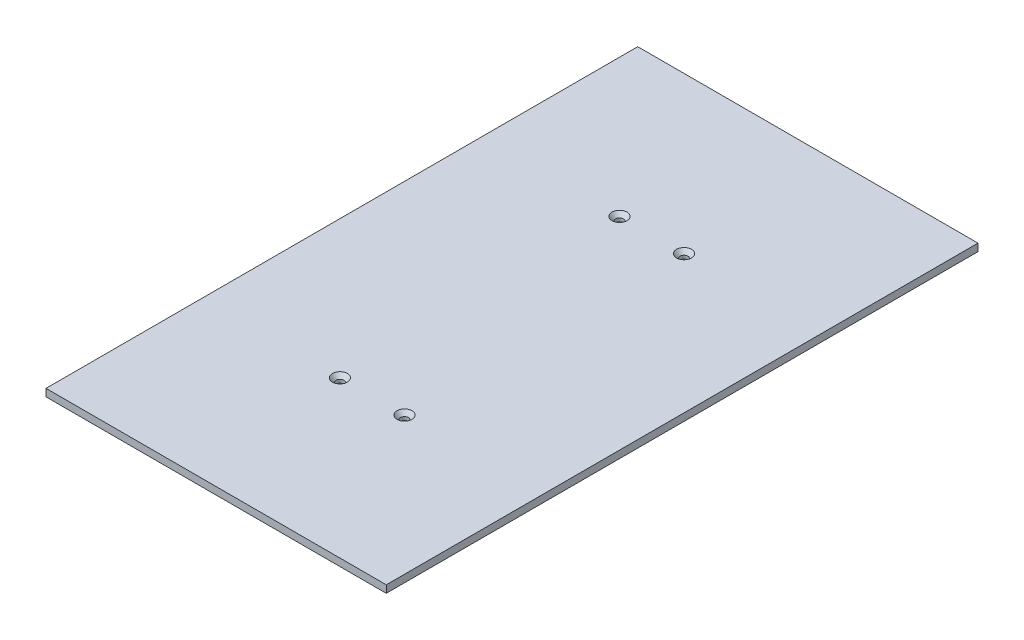
from build123d import *

# Parameters (mm, degrees)
SKETCH1_W                                     = 292.1
SKETCH1_H                                     = 508
BOSS_EXTRUDE1_DEPTH                           = 6.35
CSK_FOR_1_4_FLAT_HEAD_MACHINE_SCREW1_AT_COUNT = 2
CSK_FOR_1_4_FLAT_HEAD_MACHINE_SCREW1_AT_PITCH = 55.4
CSK_FOR_1_4_FLAT_HEAD_MACHINE_SCREW1_2_COUNT  = 2
CSK_FOR_1_4_FLAT_HEAD_MACHINE_SCREW1_2_PITCH  = 246.311104094
CSK_FOR_1_4_FLAT_HEAD_MACHINE_SCREW1_3_COUNT  = 2
CSK_FOR_1_4_FLAT_HEAD_MACHINE_SCREW1_3_PITCH  = 240


with BuildPart() as part:
    # Sketch1 → Boss-Extrude1 (new body)
    with BuildSketch(Plane(origin=(0, 0, 0), x_dir=(1, 0, 0), z_dir=(0, 1, 0))):
        with Locations((146.977170591, 231.004856512)):
            Rectangle(SKETCH1_W, SKETCH1_H)
    extrude(amount=BOSS_EXTRUDE1_DEPTH)

    # Sketch6 → CSK for 1/4 Flat Head Machine Screw1 (revolve, cut)
    with BuildSketch(Plane(origin=(119.277170591, 6.35, -351.004856512), x_dir=(0, 0, 1), z_dir=(1, 0, 0))):
        Polygon((0, 0), (0, 6.35), (3.3782, 6.35), (3.3782, 3.520932584), (6.4389, 0), align=None)
    csk_for_1_4_flat_head_machine_screw1 = revolve(axis=Axis((119.277170591, 12.7, -351.004856512), (0, -1, 0)), mode=Mode.SUBTRACT)

    # CSK for 1/4 Flat Head Machine Screw1 at: CSK for 1/4 Flat Head Machine Screw1 ×2
    with Locations(*[(i * CSK_FOR_1_4_FLAT_HEAD_MACHINE_SCREW1_AT_PITCH, 0, 0) for i in range(1, CSK_FOR_1_4_FLAT_HEAD_MACHINE_SCREW1_AT_COUNT)]):
        add(csk_for_1_4_flat_head_machine_screw1, mode=Mode.SUBTRACT)

    # CSK for 1_4 Flat Head Machine Screw1 2: CSK for 1/4 Flat Head Machine Screw1 ×2
    with Locations(*[Vector(0.22491880828425845, 0, 0.9743775088126722) * (i * CSK_FOR_1_4_FLAT_HEAD_MACHINE_SCREW1_2_PITCH) for i in range(1, CSK_FOR_1_4_FLAT_HEAD_MACHINE_SCREW1_2_COUNT)]):
        add(csk_for_1_4_flat_head_machine_screw1, mode=Mode.SUBTRACT)

    # CSK for 1_4 Flat Head Machine Screw1 3: CSK for 1/4 Flat Head Machine Screw1 ×2
    with Locations(*[(0, 0, i * CSK_FOR_1_4_FLAT_HEAD_MACHINE_SCREW1_3_PITCH) for i in range(1, CSK_FOR_1_4_FLAT_HEAD_MACHINE_SCREW1_3_COUNT)]):
        add(csk_for_1_4_flat_head_machine_screw1, mode=Mode.SUBTRACT)


solid = part.part
